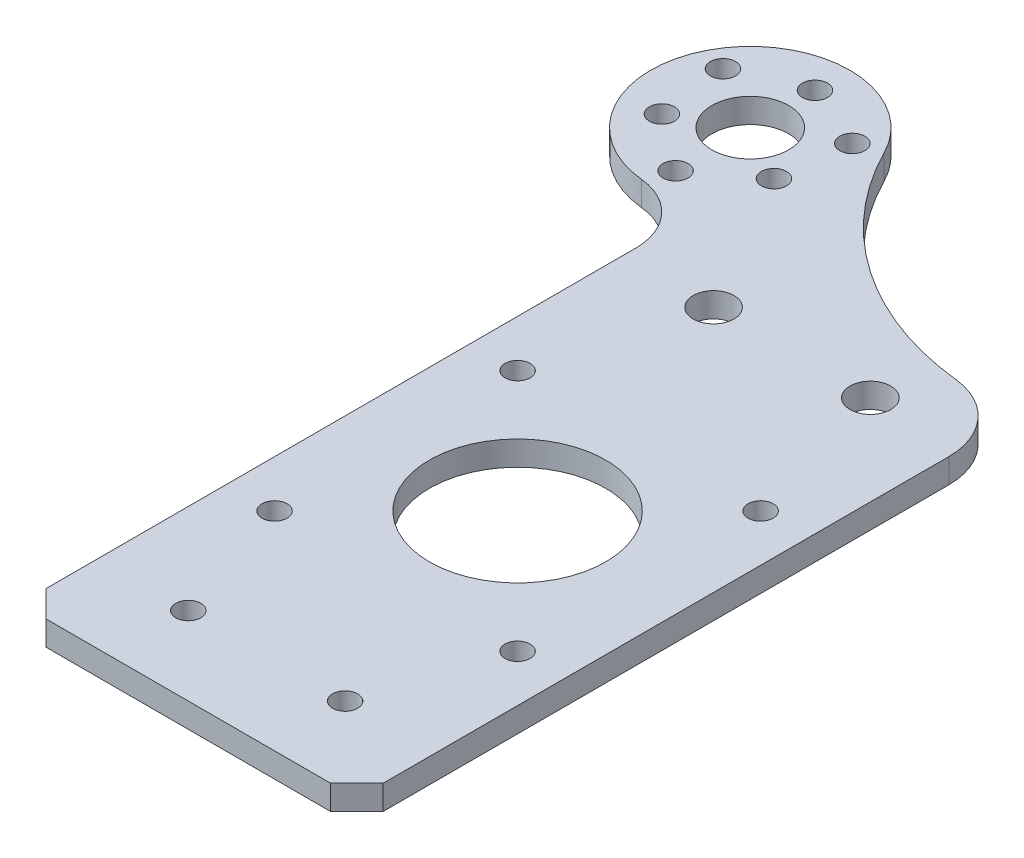
from build123d import *

# Parameters (mm, degrees)
SKETCH1_R           = 4.9
SKETCH1_R_2         = 2.6
SKETCH1_R_3         = 1.6
SKETCH1_R_4         = 11.25
BOSS_EXTRUDE1_DEPTH = 3.125
FILLET1_R           = 8
CUT_EXTRUDE1_REACH  = 120.924
SKETCH3_R           = 1.6


with BuildPart() as part:
    # Sketch1 → Boss-Extrude1 (new body)
    with BuildSketch(Plane(origin=(0, 0, 0), x_dir=(1, 0, 0), z_dir=(0, 1, 0))):
        with BuildLine():
            Line((-27.5, 86.48), (-21.5, 86.48))
            Line((-21.5, 86.48), (-21.5, 3.35))
            Line((-21.5, 3.35), (-18.15, 0))
            Line((-18.15, 0), (18.15, 0))
            Line((18.15, 0), (21.5, 3.35))
            Line((21.5, 3.35), (21.5, 75.517491819))
            ThreePointArc((21.5, 75.517491819), (19.195241391, 81.531952951), (13.461390508, 84.465996068))
            ThreePointArc((13.461390508, 84.465996068), (-3.952756456, 90.933879006), (-16.17349063, 104.924578791))
            ThreePointArc((-16.17349063, 104.924578791), (-38.32234149, 105.825820091), (-27.5, 86.48))
        make_face()
        with Locations((-27.5, 99.18)):
            Circle(SKETCH1_R, mode=Mode.SUBTRACT)
        with Locations((10, 77)):
            Circle(SKETCH1_R_2, mode=Mode.SUBTRACT)
        with Locations((-10, 77)):
            Circle(SKETCH1_R_2, mode=Mode.SUBTRACT)
        with Locations((10, 10)):
            Circle(SKETCH1_R_3, mode=Mode.SUBTRACT)
        with Locations((-10, 10)):
            Circle(SKETCH1_R_3, mode=Mode.SUBTRACT)
        with Locations((-20.355290419, 95.055)):
            Circle(SKETCH1_R_3, mode=Mode.SUBTRACT)
        with Locations((-34.644709581, 95.055)):
            Circle(SKETCH1_R_3, mode=Mode.SUBTRACT)
        with Locations((-27.5, 107.43)):
            Circle(SKETCH1_R_3, mode=Mode.SUBTRACT)
        with Locations((0, 42)):
            Circle(SKETCH1_R_4, mode=Mode.SUBTRACT)
        with Locations((-15.5, 26.5)):
            Circle(SKETCH1_R_3, mode=Mode.SUBTRACT)
        with Locations((-15.5, 57.5)):
            Circle(SKETCH1_R_3, mode=Mode.SUBTRACT)
        with Locations((15.5, 57.5)):
            Circle(SKETCH1_R_3, mode=Mode.SUBTRACT)
        with Locations((15.5, 26.5)):
            Circle(SKETCH1_R_3, mode=Mode.SUBTRACT)
    extrude(amount=BOSS_EXTRUDE1_DEPTH)

    # Fillet1
    fillet1_edges = [part.edges().sort_by_distance(p)[0] for p in [
        (-21.5, 1.5625, -86.48),
    ]]
    fillet(fillet1_edges, radius=FILLET1_R)

    # Sketch3 → Cut-Extrude1 (cut, up to next)
    with BuildSketch(Plane(origin=(0, 3.125, 0), x_dir=(1, 0, 0), z_dir=(0, 1, 0)), mode=Mode.PRIVATE) as cut_extrude1_sk1:
        with Locations((-27.5, 89.653720558)):
            Circle(SKETCH3_R)
    cut_extrude1_tool1 = extrude(cut_extrude1_sk1.sketch, amount=-CUT_EXTRUDE1_REACH, mode=Mode.PRIVATE) & part.part
    # Sketch3 → Cut-Extrude1 (cut, up to next)
    with BuildSketch(Plane(origin=(0, 3.125, 0), x_dir=(1, 0, 0), z_dir=(0, 1, 0)), mode=Mode.PRIVATE) as cut_extrude1_sk2:
        with Locations((-35.75, 103.943139721)):
            Circle(SKETCH3_R)
    cut_extrude1_tool2 = extrude(cut_extrude1_sk2.sketch, amount=-CUT_EXTRUDE1_REACH, mode=Mode.PRIVATE) & part.part
    # Sketch3 → Cut-Extrude1 (cut, up to next)
    with BuildSketch(Plane(origin=(0, 3.125, 0), x_dir=(1, 0, 0), z_dir=(0, 1, 0)), mode=Mode.PRIVATE) as cut_extrude1_sk3:
        with Locations((-19.25, 103.943139721)):
            Circle(SKETCH3_R)
    cut_extrude1_tool3 = extrude(cut_extrude1_sk3.sketch, amount=-CUT_EXTRUDE1_REACH, mode=Mode.PRIVATE) & part.part
    add(cut_extrude1_tool1.solids().sort_by_distance((-27.5, 3.125, -89.653721))[0], mode=Mode.SUBTRACT)
    add(cut_extrude1_tool2.solids().sort_by_distance((-35.75, 3.125, -103.94314))[0], mode=Mode.SUBTRACT)
    add(cut_extrude1_tool3.solids().sort_by_distance((-19.25, 3.125, -103.94314))[0], mode=Mode.SUBTRACT)


solid = part.part
